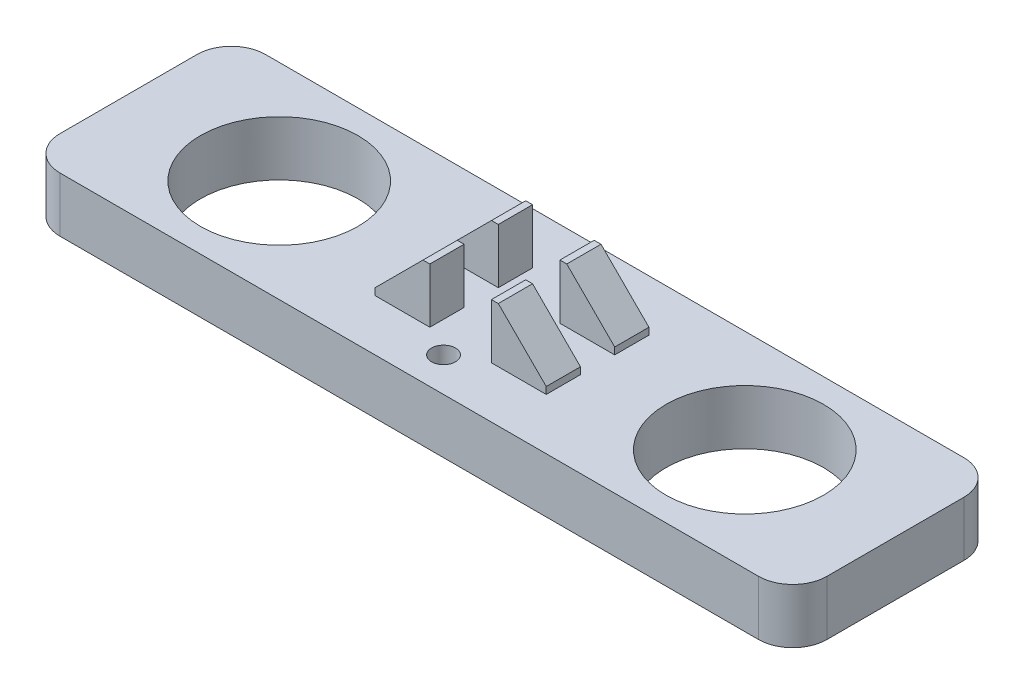
from build123d import *

# Parameters (mm, degrees)
SKETCH1_W                = 60
SKETCH1_H                = 30
SKETCH1_R                = 11.5
BOSS_EXTRUDE1_DEPTH      = 5
SKETCH2_R                = 1.75
CUT_EXTRUDE1_DEPTH       = 68.268120235
FILLET1_R                = 5
SKETCH6_R                = 1.75
SKETCH6_R_2              = 11.5
BOSS_EXTRUDE4_DEPTH      = 3
FILLET1_OF_MIRROR1_R     = 5
SKETCH7_W                = 8
SKETCH7_H                = 5
BOSS_EXTRUDE5_DEPTH      = 8
CHAMFER1_SIZE            = 7
CHAMFER1_OF_MIRROR2_SIZE = 7


with BuildPart() as part:
    # Sketch1 → Boss-Extrude1 (new body)
    with BuildSketch(Plane(origin=(0, 0, 0), x_dir=(1, 0, 0), z_dir=(0, 1, 0))):
        with Locations((30, 15)):
            Rectangle(SKETCH1_W, SKETCH1_H)
        with Locations((22, 15)):
            Circle(SKETCH1_R, mode=Mode.SUBTRACT)
    boss_extrude1 = extrude(amount=BOSS_EXTRUDE1_DEPTH)

    # Sketch2 → Cut-Extrude1 (cut, through all)
    with BuildSketch(Plane(origin=(0, 5, 0), x_dir=(1, 0, 0), z_dir=(0, 1, 0))):
        with Locations((56, 25)):
            Circle(SKETCH2_R)
        with Locations((56, 5)):
            Circle(SKETCH2_R)
    cut_extrude1 = extrude(amount=-CUT_EXTRUDE1_DEPTH, mode=Mode.SUBTRACT)

    # Fillet1
    fillet1_edges = [part.edges().sort_by_distance(p)[0] for p in [
        (0, 2.5, 0),
        (0, 2.5, -30),
    ]]
    fillet(fillet1_edges, radius=FILLET1_R)

    # Sketch6 → Boss-Extrude4 (add)
    with BuildSketch(Plane.XZ):
        with BuildLine():
            Line((60, -30), (60, 0))
            Line((60, 0), (5, 0))
            ThreePointArc((5, 0), (1.464466094, -1.464466094), (0, -5))
            Line((0, -5), (0, -25))
            ThreePointArc((0, -25), (1.464466094, -28.535533906), (5, -30))
            Line((5, -30), (60, -30))
        make_face()
        with Locations((56, -25)):
            Circle(SKETCH6_R, mode=Mode.SUBTRACT)
        with Locations((22, -15)):
            Circle(SKETCH6_R_2, mode=Mode.SUBTRACT)
        with Locations((56, -5)):
            Circle(SKETCH6_R, mode=Mode.SUBTRACT)
    boss_extrude4 = extrude(amount=BOSS_EXTRUDE4_DEPTH)


with BuildPart() as mirror1_1:
    # Mirror1: Boss-Extrude1 across plane
    add(boss_extrude1.mirror(Plane(origin=(56, 0, 0), x_dir=(0, 0, 1), z_dir=(1, 0, 0))))

    # Mirror1 2: Cut-Extrude1 across plane
    add(cut_extrude1.mirror(Plane(origin=(56, 0, 0), x_dir=(0, 0, 1), z_dir=(1, 0, 0))), mode=Mode.SUBTRACT)

    # Fillet1 of Mirror1
    fillet1_of_mirror1_edges = [mirror1_1.edges().sort_by_distance(p)[0] for p in [
        (112, 2.5, 0),
        (112, 2.5, -30),
    ]]
    fillet(fillet1_of_mirror1_edges, radius=FILLET1_OF_MIRROR1_R)


with BuildPart() as mirror1_3_1:
    # Mirror1 3: Boss-Extrude4 across plane
    add(boss_extrude4.mirror(Plane(origin=(56, 0, 0), x_dir=(0, 0, 1), z_dir=(1, 0, 0))))


with BuildPart() as part_1:
    add(part.part)

    # Mirror1 united with what the copies touc: union Mirror1_1, Mirror1 3_1
    add(mirror1_1.part)
    add(mirror1_3_1.part)

    # Sketch7 → Boss-Extrude5 (add)
    with BuildSketch(Plane(origin=(0, 5, 0), x_dir=(1, 0, 0), z_dir=(0, 1, 0))):
        with Locations((47.5, 20)):
            Rectangle(SKETCH7_W, SKETCH7_H)
        with Locations((64.5, 20)):
            Rectangle(SKETCH7_W, SKETCH7_H)
    boss_extrude5 = extrude(amount=BOSS_EXTRUDE5_DEPTH)

    # Chamfer1
    chamfer1_edges = [part_1.edges().sort_by_distance(p)[0] for p in [
        (68.5, 13, -20),
        (43.5, 13, -20),
    ]]
    chamfer(chamfer1_edges, length=CHAMFER1_SIZE)

    # Mirror2: Boss-Extrude5 across plane
    add(boss_extrude5.mirror(Plane(origin=(0, 0, -15), x_dir=(1, 0, 0), z_dir=(0, 0, -1))))

    # Chamfer1 of Mirror2
    chamfer1_of_mirror2_edges = [part_1.edges().sort_by_distance(p)[0] for p in [
        (68.5, 13, -10),
        (43.5, 13, -10),
    ]]
    chamfer(chamfer1_of_mirror2_edges, length=CHAMFER1_OF_MIRROR2_SIZE)


solid = part_1.part
